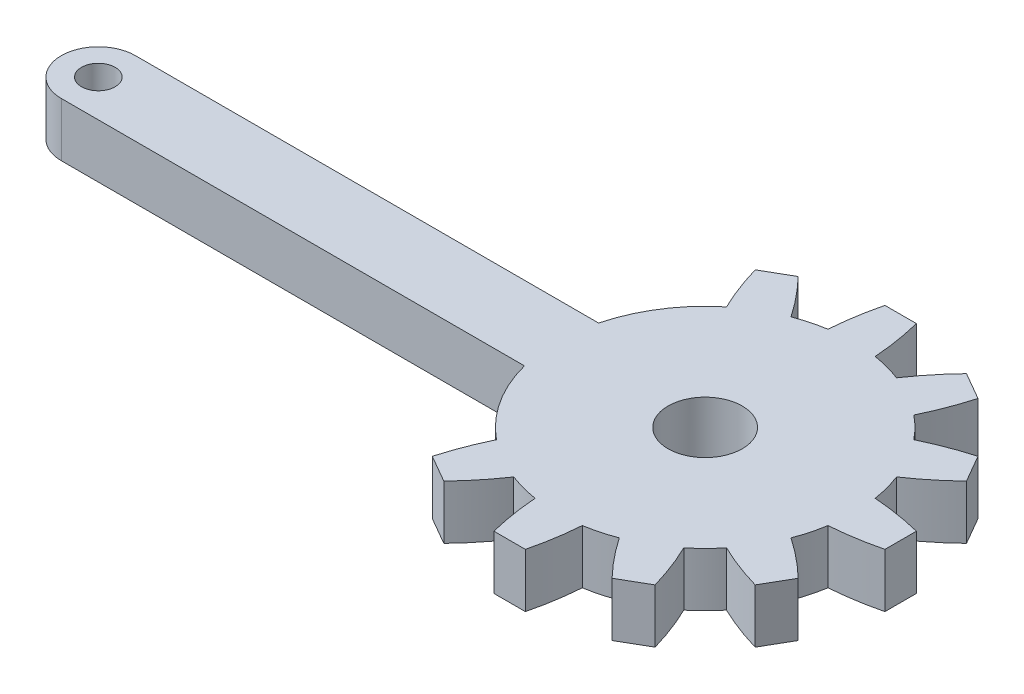
from build123d import *

# Parameters (mm, degrees)
BOSS_EXTRUDE1_DEPTH            = 4
BOSS_EXTRUDE1_2_DEPTH          = 4
SKETCH3_R                      = 2.75
CUT_EXTRUDE5_DEPTH             = 10
BOSS_EXTRUDE2_DEPTH            = 4
SKETCH6_R                      = 1.25
CUT_EXTRUDE4_DEPTH             = 30
BODY_DELETE_KEEP_2_OUTLINE_R   = 2.75
BODY_DELETE_KEEP_2_OUTLINE_R_2 = 1.25
BODY_DELETE_KEEP_2_DEPTH       = 4


# Read off the part's stored shape, not the designer's step: Body-Delete/Keep 2
with BuildPart() as part:
    # Sketch1 → Boss-Extrude1 (new body)
    with BuildSketch(Plane(origin=(0, 0, 0), x_dir=(1, 0, 0), z_dir=(0, 1, 0))):
        with BuildLine():
            Line((1.167045764, 14.5), (-1.167045764, 14.5))
            add(Edge.make_bspline(
                [(-1.75, 10.859903314), (-1.614394474, 12.705744996), (-1.167045764, 14.5)],
                knots=[0, 0, 0, 1, 1, 1], degree=2))
            ThreePointArc((-1.75, 10.859903314), (-2.847009496, 10.625184089), (-3.914407201, 10.279952153))
            add(Edge.make_bspline(
                [(-3.914407201, 10.279952153), (-4.954765872, 11.810695178), (-6.239308721, 13.140891237)],
                knots=[0, 0, 0, 1, 1, 1], degree=2))
            Line((-6.239308721, 13.140891237), (-8.260691279, 11.973845473))
            add(Edge.make_bspline(
                [(-6.945496114, 8.529952153), (-7.750979124, 10.196300704), (-8.260691279, 11.973845473)],
                knots=[0, 0, 0, 1, 1, 1], degree=2))
            ThreePointArc((-6.945496114, 8.529952153), (-11, 0), (-6.945496114, -8.529952153))
            add(Edge.make_bspline(
                [(-6.945496114, -8.529952153), (-7.750979124, -10.196300704), (-8.260691279, -11.973845473)],
                knots=[0, 0, 0, 1, 1, 1], degree=2))
            Line((-8.260691279, -11.973845473), (-6.239308721, -13.140891237))
            add(Edge.make_bspline(
                [(-3.914407201, -10.279952153), (-4.954765872, -11.810695178), (-6.239308721, -13.140891237)],
                knots=[0, 0, 0, 1, 1, 1], degree=2))
            ThreePointArc((-3.914407201, -10.279952153), (-2.847009496, -10.625184089), (-1.75, -10.859903314))
            add(Edge.make_bspline(
                [(-1.75, -10.859903314), (-1.614394474, -12.705744996), (-1.167045764, -14.5)],
                knots=[0, 0, 0, 1, 1, 1], degree=2))
            Line((-1.167045764, -14.5), (1.167045764, -14.5))
            add(Edge.make_bspline(
                [(1.75, -10.859903314), (1.614394474, -12.705744996), (1.167045764, -14.5)],
                knots=[0, 0, 0, 1, 1, 1], degree=2))
            ThreePointArc((1.75, -10.859903314), (2.847009496, -10.625184089), (3.914407201, -10.279952153))
            add(Edge.make_bspline(
                [(3.914407201, -10.279952153), (4.954765872, -11.810695178), (6.239308721, -13.140891237)],
                knots=[0, 0, 0, 1, 1, 1], degree=2))
            Line((6.239308721, -13.140891237), (8.260691279, -11.973845473))
            add(Edge.make_bspline(
                [(6.945496114, -8.529952153), (7.750979124, -10.196300704), (8.260691279, -11.973845473)],
                knots=[0, 0, 0, 1, 1, 1], degree=2))
            ThreePointArc((6.945496114, -8.529952153), (7.778174593, -7.778174593), (8.529952153, -6.945496114))
            add(Edge.make_bspline(
                [(8.529952153, -6.945496114), (10.196300704, -7.750979124), (11.973845473, -8.260691279)],
                knots=[0, 0, 0, 1, 1, 1], degree=2))
            Line((11.973845473, -8.260691279), (13.140891237, -6.239308721))
            add(Edge.make_bspline(
                [(10.279952153, -3.914407201), (11.810695178, -4.954765872), (13.140891237, -6.239308721)],
                knots=[0, 0, 0, 1, 1, 1], degree=2))
            ThreePointArc((10.279952153, -3.914407201), (10.625184089, -2.847009496), (10.859903314, -1.75))
            add(Edge.make_bspline(
                [(10.859903314, -1.75), (12.705744996, -1.614394474), (14.5, -1.167045764)],
                knots=[0, 0, 0, 1, 1, 1], degree=2))
            Line((14.5, -1.167045764), (14.5, 1.167045764))
            add(Edge.make_bspline(
                [(10.859903314, 1.75), (12.705744996, 1.614394474), (14.5, 1.167045764)],
                knots=[0, 0, 0, 1, 1, 1], degree=2))
            ThreePointArc((10.859903314, 1.75), (10.625184089, 2.847009496), (10.279952153, 3.914407201))
            add(Edge.make_bspline(
                [(10.279952153, 3.914407201), (11.810695178, 4.954765872), (13.140891237, 6.239308721)],
                knots=[0, 0, 0, 1, 1, 1], degree=2))
            Line((13.140891237, 6.239308721), (11.973845473, 8.260691279))
            add(Edge.make_bspline(
                [(8.529952153, 6.945496114), (10.196300704, 7.750979124), (11.973845473, 8.260691279)],
                knots=[0, 0, 0, 1, 1, 1], degree=2))
            ThreePointArc((8.529952153, 6.945496114), (7.778174593, 7.778174593), (6.945496114, 8.529952153))
            add(Edge.make_bspline(
                [(6.945496114, 8.529952153), (7.750979124, 10.196300704), (8.260691279, 11.973845473)],
                knots=[0, 0, 0, 1, 1, 1], degree=2))
            Line((8.260691279, 11.973845473), (6.239308721, 13.140891237))
            add(Edge.make_bspline(
                [(3.914407201, 10.279952153), (4.954765872, 11.810695178), (6.239308721, 13.140891237)],
                knots=[0, 0, 0, 1, 1, 1], degree=2))
            ThreePointArc((3.914407201, 10.279952153), (2.847009496, 10.625184089), (1.75, 10.859903314))
            add(Edge.make_bspline(
                [(1.75, 10.859903314), (1.614394474, 12.705744996), (1.167045764, 14.5)],
                knots=[0, 0, 0, 1, 1, 1], degree=2))
        make_face()
    extrude(amount=BOSS_EXTRUDE1_DEPTH)


with BuildPart() as body_2:
    # Sketch1 → Boss-Extrude1 2 (new body)
    with BuildSketch(Plane(origin=(0, 0, 0), x_dir=(1, 0, 0), z_dir=(0, 1, 0))):
        with BuildLine():
            add(Edge.make_bspline(
                [(34.870054214, 9.863192787), (35.186170623, 11.683486975), (35.362460844, 13.522249764)],
                knots=[0, 0, 0, 1, 1, 1], degree=2))
            Line((35.362460844, 13.522249764), (33.134723393, 14.204954567))
            add(Edge.make_bspline(
                [(31.5252137, 10.893746976), (32.106045864, 12.660345794), (33.134723393, 14.204954567)],
                knots=[0, 0, 0, 1, 1, 1], degree=2))
            ThreePointArc((31.5252137, 10.893746976), (30.40772436, 10.992441078), (29.285994273, 10.976802623))
            add(Edge.make_bspline(
                [(29.285994273, 10.976802623), (28.64961202, 12.711281837), (27.882902436, 14.391842235)],
                knots=[0, 0, 0, 1, 1, 1], degree=2))
            Line((27.882902436, 14.391842235), (25.612272809, 13.869213211))
            add(Edge.make_bspline(
                [(25.874000322, 10.196868473), (25.493716323, 12.01720401), (25.612272809, 13.869213211)],
                knots=[0, 0, 0, 1, 1, 1], degree=2))
            ThreePointArc((25.874000322, 10.196868473), (24.856879115, 9.723595403), (23.893251591, 9.14918706))
            add(Edge.make_bspline(
                [(23.893251591, 9.14918706), (22.474888786, 10.333098996), (20.97061861, 11.4051522)],
                knots=[0, 0, 0, 1, 1, 1], degree=2))
            Line((20.97061861, 11.4051522), (19.265510182, 9.817227376))
            add(Edge.make_bspline(
                [(21.328345227, 6.767747298), (20.088841854, 8.154062117), (19.265510182, 9.817227376)],
                knots=[0, 0, 0, 1, 1, 1], degree=2))
            ThreePointArc((21.328345227, 6.767747298), (20.684128957, 5.849320193), (20.136807213, 4.870054214))
            add(Edge.make_bspline(
                [(20.136807213, 4.870054214), (18.316513025, 5.186170623), (16.477750236, 5.362460844)],
                knots=[0, 0, 0, 1, 1, 1], degree=2))
            Line((16.477750236, 5.362460844), (15.795045433, 3.134723393))
            add(Edge.make_bspline(
                [(19.106253024, 1.5252137), (17.339654206, 2.106045864), (15.795045433, 3.134723393)],
                knots=[0, 0, 0, 1, 1, 1], degree=2))
            ThreePointArc((19.106253024, 1.5252137), (19.007558922, 0.40772436), (19.023197377, -0.714005727))
            add(Edge.make_bspline(
                [(19.023197377, -0.714005727), (17.288718163, -1.35038798), (15.608157765, -2.117097564)],
                knots=[0, 0, 0, 1, 1, 1], degree=2))
            Line((15.608157765, -2.117097564), (16.130786789, -4.387727191))
            add(Edge.make_bspline(
                [(19.803131527, -4.125999678), (17.98279599, -4.506283677), (16.130786789, -4.387727191)],
                knots=[0, 0, 0, 1, 1, 1], degree=2))
            ThreePointArc((19.803131527, -4.125999678), (20.276404597, -5.143120885), (20.85081294, -6.106748409))
            add(Edge.make_bspline(
                [(20.85081294, -6.106748409), (19.666901004, -7.525111214), (18.5948478, -9.02938139)],
                knots=[0, 0, 0, 1, 1, 1], degree=2))
            Line((18.5948478, -9.02938139), (20.182772624, -10.734489818))
            add(Edge.make_bspline(
                [(23.232252702, -8.671654773), (21.845937883, -9.911158146), (20.182772624, -10.734489818)],
                knots=[0, 0, 0, 1, 1, 1], degree=2))
            ThreePointArc((23.232252702, -8.671654773), (24.150679807, -9.315871043), (25.129945786, -9.863192787))
            add(Edge.make_bspline(
                [(25.129945786, -9.863192787), (24.813829377, -11.683486975), (24.637539156, -13.522249764)],
                knots=[0, 0, 0, 1, 1, 1], degree=2))
            Line((24.637539156, -13.522249764), (26.865276607, -14.204954567))
            add(Edge.make_bspline(
                [(28.4747863, -10.893746976), (27.893954136, -12.660345794), (26.865276607, -14.204954567)],
                knots=[0, 0, 0, 1, 1, 1], degree=2))
            ThreePointArc((28.4747863, -10.893746976), (29.59227564, -10.992441078), (30.714005727, -10.976802623))
            add(Edge.make_bspline(
                [(30.714005727, -10.976802623), (31.35038798, -12.711281837), (32.117097564, -14.391842235)],
                knots=[0, 0, 0, 1, 1, 1], degree=2))
            Line((32.117097564, -14.391842235), (34.387727191, -13.869213211))
            add(Edge.make_bspline(
                [(34.125999678, -10.196868473), (34.506283677, -12.01720401), (34.387727191, -13.869213211)],
                knots=[0, 0, 0, 1, 1, 1], degree=2))
            ThreePointArc((34.125999678, -10.196868473), (35.143120885, -9.723595403), (36.106748409, -9.14918706))
            add(Edge.make_bspline(
                [(36.106748409, -9.14918706), (37.525111214, -10.333098996), (39.02938139, -11.4051522)],
                knots=[0, 0, 0, 1, 1, 1], degree=2))
            Line((39.02938139, -11.4051522), (40.734489818, -9.817227376))
            add(Edge.make_bspline(
                [(38.671654773, -6.767747298), (39.911158146, -8.154062117), (40.734489818, -9.817227376)],
                knots=[0, 0, 0, 1, 1, 1], degree=2))
            ThreePointArc((38.671654773, -6.767747298), (40.723409561, 2.451221613), (34.870054214, 9.863192787))
        make_face()
    extrude(amount=BOSS_EXTRUDE1_2_DEPTH)


with BuildPart() as cut_extrude5_tool:
    # Sketch3 → Cut-Extrude5 (new body)
    with BuildSketch(Plane(origin=(0, 0, 0), x_dir=(-1, 0, 0), z_dir=(0, -1, 0))):
        with Locations(Location((0, 0, 0), (0, 0, 90))):
            Circle(SKETCH3_R)
        with Locations(Location((-30, 0, 0), (0, 0, 90))):
            Circle(SKETCH3_R)
    extrude(amount=-CUT_EXTRUDE5_DEPTH)


with BuildPart() as part_1:
    add(part.part)

    # Cut-Extrude5: cut by cut_extrude5_tool
    add(cut_extrude5_tool.part, mode=Mode.SUBTRACT)



with BuildPart() as body_2_1:
    add(body_2.part)

    # Cut-Extrude5: cut by cut_extrude5_tool
    add(cut_extrude5_tool.part, mode=Mode.SUBTRACT)


with BuildPart() as part_2:
    add(part_1.part)

    add(body_2_1.part)  # Boss-Extrude2 merges body 2
    # Sketch4 → Boss-Extrude2 (add)
    with BuildSketch(Plane(origin=(0, 0, 0), x_dir=(1, 0, 0), z_dir=(0, 1, 0))):
        with BuildLine():
            Line((0, 2.75), (-45, 2.75))
            ThreePointArc((-45, 2.75), (-47.75, 0), (-45, -2.75))
            Line((-45, -2.75), (0, -2.75))
            ThreePointArc((0, -2.75), (-2.75, 0), (0, 2.75))
        make_face()
        with BuildLine():
            Line((75, -2.75), (30, -2.75))
            ThreePointArc((30, -2.75), (32.75, 0), (30, 2.75))
            Line((30, 2.75), (75, 2.75))
            ThreePointArc((75, 2.75), (77.75, 0), (75, -2.75))
        make_face()
    extrude(amount=BOSS_EXTRUDE2_DEPTH)

    # Sketch6 → Cut-Extrude4 (cut)
    with BuildSketch(Plane(origin=(0, 0, 0), x_dir=(1, 0, 0), z_dir=(0, 1, 0))):
        with Locations(Location((-45, 0, 0), (0, 0, 270))):
            Circle(SKETCH6_R)
        with Locations(Location((75, 0, 0), (0, 0, 270))):
            Circle(SKETCH6_R)
    extrude(amount=CUT_EXTRUDE4_DEPTH, mode=Mode.SUBTRACT)

    # Body-Delete/Keep 2 outline → Body-Delete/Keep 2 (cut)
    with BuildSketch(Plane(origin=(0, 0, 0), x_dir=(1, 0, 0), z_dir=(0, 1, 0))):
        with BuildLine():
            ThreePointArc((25.874000322, 10.196868473), (24.856879115, 9.723595403), (23.893251591, 9.14918706))
            add(Edge.make_bspline(
                [(23.893251591, 9.14918706), (22.474888786, 10.333098996), (20.97061861, 11.4051522)],
                knots=[0, 0, 0, 1, 1, 1], degree=2))
            Line((20.97061861, 11.4051522), (19.265510182, 9.817227376))
            add(Edge.make_bspline(
                [(21.328345227, 6.767747298), (20.088841854, 8.154062117), (19.265510182, 9.817227376)],
                knots=[0, 0, 0, 1, 1, 1], degree=2))
            ThreePointArc((21.328345227, 6.767747298), (20.684128957, 5.849320193), (20.136807213, 4.870054214))
            add(Edge.make_bspline(
                [(20.136807213, 4.870054214), (18.316513025, 5.186170623), (16.477750236, 5.362460844)],
                knots=[0, 0, 0, 1, 1, 1], degree=2))
            Line((16.477750236, 5.362460844), (15.795045433, 3.134723393))
            add(Edge.make_bspline(
                [(19.106253024, 1.5252137), (17.339654206, 2.106045864), (15.795045433, 3.134723393)],
                knots=[0, 0, 0, 1, 1, 1], degree=2))
            ThreePointArc((19.106253024, 1.5252137), (19.007558922, 0.40772436), (19.023197377, -0.714005727))
            add(Edge.make_bspline(
                [(19.023197377, -0.714005727), (17.288718163, -1.35038798), (15.608157765, -2.117097564)],
                knots=[0, 0, 0, 1, 1, 1], degree=2))
            Line((15.608157765, -2.117097564), (16.130786789, -4.387727191))
            add(Edge.make_bspline(
                [(19.803131527, -4.125999678), (17.98279599, -4.506283677), (16.130786789, -4.387727191)],
                knots=[0, 0, 0, 1, 1, 1], degree=2))
            ThreePointArc((19.803131527, -4.125999678), (20.276404597, -5.143120885), (20.85081294, -6.106748409))
            add(Edge.make_bspline(
                [(20.85081294, -6.106748409), (19.666901004, -7.525111214), (18.5948478, -9.02938139)],
                knots=[0, 0, 0, 1, 1, 1], degree=2))
            Line((18.5948478, -9.02938139), (20.182772624, -10.734489818))
            add(Edge.make_bspline(
                [(23.232252702, -8.671654773), (21.845937883, -9.911158146), (20.182772624, -10.734489818)],
                knots=[0, 0, 0, 1, 1, 1], degree=2))
            ThreePointArc((23.232252702, -8.671654773), (24.150679807, -9.315871043), (25.129945786, -9.863192787))
            add(Edge.make_bspline(
                [(25.129945786, -9.863192787), (24.813829377, -11.683486975), (24.637539156, -13.522249764)],
                knots=[0, 0, 0, 1, 1, 1], degree=2))
            Line((24.637539156, -13.522249764), (26.865276607, -14.204954567))
            add(Edge.make_bspline(
                [(28.4747863, -10.893746976), (27.893954136, -12.660345794), (26.865276607, -14.204954567)],
                knots=[0, 0, 0, 1, 1, 1], degree=2))
            ThreePointArc((28.4747863, -10.893746976), (29.59227564, -10.992441078), (30.714005727, -10.976802623))
            add(Edge.make_bspline(
                [(30.714005727, -10.976802623), (31.35038798, -12.711281837), (32.117097564, -14.391842235)],
                knots=[0, 0, 0, 1, 1, 1], degree=2))
            Line((32.117097564, -14.391842235), (34.387727191, -13.869213211))
            add(Edge.make_bspline(
                [(34.125999678, -10.196868473), (34.506283677, -12.01720401), (34.387727191, -13.869213211)],
                knots=[0, 0, 0, 1, 1, 1], degree=2))
            ThreePointArc((34.125999678, -10.196868473), (35.143120885, -9.723595403), (36.106748409, -9.14918706))
            add(Edge.make_bspline(
                [(36.106748409, -9.14918706), (37.525111214, -10.333098996), (39.02938139, -11.4051522)],
                knots=[0, 0, 0, 1, 1, 1], degree=2))
            Line((39.02938139, -11.4051522), (40.734489818, -9.817227376))
            add(Edge.make_bspline(
                [(38.671654773, -6.767747298), (39.911158146, -8.154062117), (40.734489818, -9.817227376)],
                knots=[0, 0, 0, 1, 1, 1], degree=2))
            ThreePointArc((38.671654773, -6.767747298), (39.867824605, -4.860662256), (40.650704202, -2.75))
            Line((40.650704202, -2.75), (75, -2.75))
            ThreePointArc((75, -2.75), (77.75, 0), (75, 2.75))
            Line((75, 2.75), (40.650704202, 2.75))
            ThreePointArc((40.650704202, 2.75), (38.536560394, 6.93737246), (34.870054214, 9.863192787))
            add(Edge.make_bspline(
                [(34.870054214, 9.863192787), (35.186170623, 11.683486975), (35.362460844, 13.522249764)],
                knots=[0, 0, 0, 1, 1, 1], degree=2))
            Line((35.362460844, 13.522249764), (33.134723393, 14.204954567))
            add(Edge.make_bspline(
                [(31.5252137, 10.893746976), (32.106045864, 12.660345794), (33.134723393, 14.204954567)],
                knots=[0, 0, 0, 1, 1, 1], degree=2))
            ThreePointArc((31.5252137, 10.893746976), (30.40772436, 10.992441078), (29.285994273, 10.976802623))
            add(Edge.make_bspline(
                [(29.285994273, 10.976802623), (28.64961202, 12.711281837), (27.882902436, 14.391842235)],
                knots=[0, 0, 0, 1, 1, 1], degree=2))
            Line((27.882902436, 14.391842235), (25.612272809, 13.869213211))
            add(Edge.make_bspline(
                [(25.874000322, 10.196868473), (25.493716323, 12.01720401), (25.612272809, 13.869213211)],
                knots=[0, 0, 0, 1, 1, 1], degree=2))
        make_face()
        with Locations((30, 0)):
            Circle(BODY_DELETE_KEEP_2_OUTLINE_R, mode=Mode.SUBTRACT)
        with Locations((75, 0)):
            Circle(BODY_DELETE_KEEP_2_OUTLINE_R_2, mode=Mode.SUBTRACT)
    extrude(amount=BODY_DELETE_KEEP_2_DEPTH, mode=Mode.SUBTRACT)


solid = part_2.part
